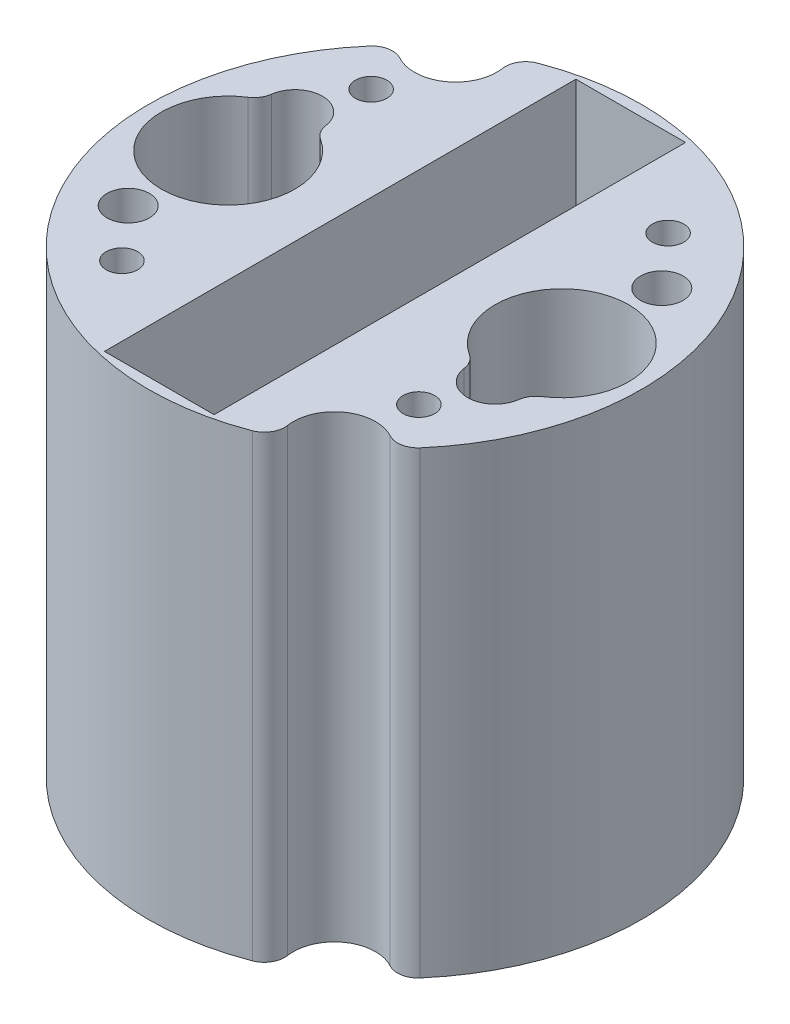
from build123d import *

# Parameters (mm, degrees)
BOSS_EXTRUDE1_OUTLINE_R   = 36
BOSS_EXTRUDE1_OUTLINE_R_2 = 9.75
BOSS_EXTRUDE1_OUTLINE_W   = 16
BOSS_EXTRUDE1_OUTLINE_H   = 68.8
BOSS_EXTRUDE1_DEPTH       = 64
BOSS_EXTRUDE2_START       = 3
SKETCH2_R                 = 36
BOSS_EXTRUDE2_DEPTH       = 3
SKETCH1_2_R               = 9.75
BOSS_EXTRUDE3_DEPTH       = 12
SKETCH4_R                 = 4
CUT_EXTRUDE1_DEPTH        = 52
SKETCH5_R                 = 1.5
CUT_EXTRUDE2_DEPTH        = 20
SKETCH5_3_R               = 2.3
SKETCH5_3_R_2             = 1.5
CUT_EXTRUDE3_DEPTH        = 6
CUT_EXTRUDE4_DEPTH        = 85.148677946
CUT_EXTRUDE4_DEPTH_BACK   = 85.148677946
SKETCH6_R                 = 3.1
CUT_EXTRUDE5_DEPTH        = 85.148677946
FILLET1_R                 = 3
CIRPATTERN1_COUNT         = 2
FILLET1_OF_CIRPATTERN1_R  = 3
BOSS_EXTRUDE4_DEPTH       = 4
SKETCH9_W                 = 16
SKETCH9_H                 = 68.8
CUT_EXTRUDE6_DEPTH        = 2.5


# Read off the part's stored shape, not the designer's step: Boss-Extrude1
with BuildPart() as part:
    # Boss-Extrude1 outline → Boss-Extrude1 (new body)
    with BuildSketch(Plane(origin=(0, 0, 0), x_dir=(1, 0, 0), z_dir=(0, 1, 0))):
        Circle(BOSS_EXTRUDE1_OUTLINE_R)
        with Locations((-24.35, 0)):
            Circle(BOSS_EXTRUDE1_OUTLINE_R_2, mode=Mode.SUBTRACT)
        Rectangle(BOSS_EXTRUDE1_OUTLINE_W, BOSS_EXTRUDE1_OUTLINE_H, mode=Mode.SUBTRACT)
        with Locations((24.35, 0)):
            Circle(BOSS_EXTRUDE1_OUTLINE_R_2, mode=Mode.SUBTRACT)
    extrude(amount=BOSS_EXTRUDE1_DEPTH)

    # Sketch2 → Boss-Extrude2 (add)
    with BuildSketch(Plane.XZ.offset(BOSS_EXTRUDE2_START)):
        with Locations(Location((0, 0, 0), (0, 0, 270))):
            Circle(SKETCH2_R)
    extrude(amount=-BOSS_EXTRUDE2_DEPTH)

    # Sketch1<2> → Boss-Extrude3 (add)
    with BuildSketch(Plane(origin=(0, 0, 0), x_dir=(1, 0, 0), z_dir=(0, 1, 0))):
        with Locations(Location((-24.35, 0, 0), (0, 0, 270))):
            Circle(SKETCH1_2_R)
        with Locations(Location((24.35, 0, 0), (0, 0, 270))):
            Circle(SKETCH1_2_R)
    extrude(amount=BOSS_EXTRUDE3_DEPTH)

    # Sketch4 → Cut-Extrude1 (cut)
    with BuildSketch(Plane(origin=(0, 64, 0), x_dir=(1, 0, 0), z_dir=(0, 1, 0))):
        with Locations((-24.35, 9.75)):
            Circle(SKETCH4_R)
        with Locations((24.35, -9.75)):
            Circle(SKETCH4_R)
    extrude(amount=-CUT_EXTRUDE1_DEPTH, mode=Mode.SUBTRACT)

    # Sketch5 → Cut-Extrude2 (cut)
    with BuildSketch(Plane(origin=(0, 64, 0), x_dir=(1, 0, 0), z_dir=(0, 1, 0))):
        with Locations(Location((-21.667008817, 18.180779107, 0), (0, 0, 270))):
            Circle(SKETCH5_R)
        with Locations(Location((18.180779107, 21.667008817, 0), (0, 0, 270))):
            Circle(SKETCH5_R)
        with Locations(Location((-18.180779107, -21.667008817, 0), (0, 0, 270))):
            Circle(SKETCH5_R)
        with Locations(Location((21.667008817, -18.180779107, 0), (0, 0, 270))):
            Circle(SKETCH5_R)
    extrude(amount=-CUT_EXTRUDE2_DEPTH, mode=Mode.SUBTRACT)

    # Sketch5<3> → Cut-Extrude3 (cut)
    # profile 1 of 4: a face of its own
    with BuildSketch(Plane(origin=(0, 64, 0), x_dir=(1, 0, 0), z_dir=(0, 1, 0))):
        with Locations(Location((-21.667008817, 18.180779107, 0), (0, 0, 270))):
            Circle(SKETCH5_3_R)
        with Locations(Location((-21.667008817, 18.180779107, 0), (0, 0, 270))):
            Circle(SKETCH5_3_R_2, mode=Mode.SUBTRACT)
    # profile 2 of 4: a face of its own
    with BuildSketch(Plane(origin=(0, 64, 0), x_dir=(1, 0, 0), z_dir=(0, 1, 0))):
        with Locations(Location((18.180779107, 21.667008817, 0), (0, 0, 270))):
            Circle(SKETCH5_3_R)
        with Locations(Location((18.180779107, 21.667008817, 0), (0, 0, 270))):
            Circle(SKETCH5_3_R_2, mode=Mode.SUBTRACT)
    # profile 3 of 4: a face of its own
    with BuildSketch(Plane(origin=(0, 64, 0), x_dir=(1, 0, 0), z_dir=(0, 1, 0))):
        with Locations(Location((21.667008817, -18.180779107, 0), (0, 0, 270))):
            Circle(SKETCH5_3_R)
        with Locations(Location((21.667008817, -18.180779107, 0), (0, 0, 270))):
            Circle(SKETCH5_3_R_2, mode=Mode.SUBTRACT)
    # profile 4 of 4: a face of its own
    with BuildSketch(Plane(origin=(0, 64, 0), x_dir=(1, 0, 0), z_dir=(0, 1, 0))):
        with Locations(Location((-18.180779107, -21.667008817, 0), (0, 0, 270))):
            Circle(SKETCH5_3_R)
        with Locations(Location((-18.180779107, -21.667008817, 0), (0, 0, 270))):
            Circle(SKETCH5_3_R_2, mode=Mode.SUBTRACT)
    extrude(amount=-CUT_EXTRUDE3_DEPTH, mode=Mode.SUBTRACT)

    # Sketch6 → Cut-Extrude4 (cut, two sides: drawn at the far end of the back side and taken through both)
    with BuildSketch(Plane(origin=(0, 64, 0), x_dir=(1, 0, 0), z_dir=(0, 1, 0)).offset(-CUT_EXTRUDE4_DEPTH_BACK)):
        with Locations(Location((-24.681724008, -14.25, 0), (0, 0, 270))):
            Circle(SKETCH6_R)
        with Locations(Location((24.681724008, 14.25, 0), (0, 0, 270))):
            Circle(SKETCH6_R)
    extrude(amount=CUT_EXTRUDE4_DEPTH + CUT_EXTRUDE4_DEPTH_BACK, mode=Mode.SUBTRACT)

    # Sketch7 → Cut-Extrude5 (cut, symmetric)
    with BuildSketch(Plane(origin=(0, 64, 0), x_dir=(1, 0, 0), z_dir=(0, 1, 0))):
        with BuildLine():
            ThreePointArc((-25.259780357, 25.650409281), (-17.207293091, 24.574561329), (-15.464146624, 32.509385863))
            ThreePointArc((-15.464146624, 32.509385863), (-20.648751709, 29.489473594), (-25.259780357, 25.650409281))
        make_face()
    cut_extrude5 = extrude(amount=CUT_EXTRUDE5_DEPTH, both=True, mode=Mode.SUBTRACT)

    # Fillet1
    fillet1_edges = [part.edges().sort_by_distance(p)[0] for p in [
        (-25.259780357, 30.5, -25.650409281),
        (-15.464146624, 30.5, -32.509385863),
        (-20.435059552, 38, -8.929487179),
        (-28.264940448, 38, -8.929487179),
        (20.435059552, 38, 8.929487179),
        (28.264940448, 38, 8.929487179),
    ]]
    fillet(fillet1_edges, radius=FILLET1_R)

    # CirPattern1: Cut-Extrude5 ×2 about axis
    cirpattern1_axis = Axis((0, 0, 0), (0, 1, 0))
    for i in range(1, CIRPATTERN1_COUNT):
        add(cut_extrude5.rotate(cirpattern1_axis, i * 360 / CIRPATTERN1_COUNT), mode=Mode.SUBTRACT)

    # Fillet1 of CirPattern1
    fillet1_of_cirpattern1_edges = [part.edges().sort_by_distance(p)[0] for p in [
        (25.259780357, 30.5, 25.650409281),
        (15.464146624, 30.5, 32.509385863),
        (20.435059552, 38, 8.929487179),
        (28.264940448, 38, 8.929487179),
        (-20.435059552, 38, -8.929487179),
        (-28.264940448, 38, -8.929487179),
    ]]
    fillet(fillet1_of_cirpattern1_edges, radius=FILLET1_OF_CIRPATTERN1_R)

    # Sketch8 → Boss-Extrude4 (add)
    with BuildSketch(Plane(origin=(0, 12, 0), x_dir=(1, 0, 0), z_dir=(0, 1, 0))):
        with BuildLine():
            ThreePointArc((20.386907649, -10.292124542), (24.35, -13.75), (28.313092351, -10.292124542))
            ThreePointArc((28.313092351, -10.292124542), (28.752934813, -9.090438977), (29.653550058, -8.181372549))
            ThreePointArc((29.653550058, -8.181372549), (24.35, 9.75), (19.046449942, -8.181372549))
            ThreePointArc((19.046449942, -8.181372549), (19.947065187, -9.090438977), (20.386907649, -10.292124542))
        make_face()
    extrude(amount=BOSS_EXTRUDE4_DEPTH)

    # Sketch9 → Cut-Extrude6 (cut)
    with BuildSketch(Plane(origin=(0, 0, 0), x_dir=(1, 0, 0), z_dir=(0, 1, 0))):
        Rectangle(SKETCH9_W, SKETCH9_H)
    extrude(amount=-CUT_EXTRUDE6_DEPTH, mode=Mode.SUBTRACT)


solid = part.part
